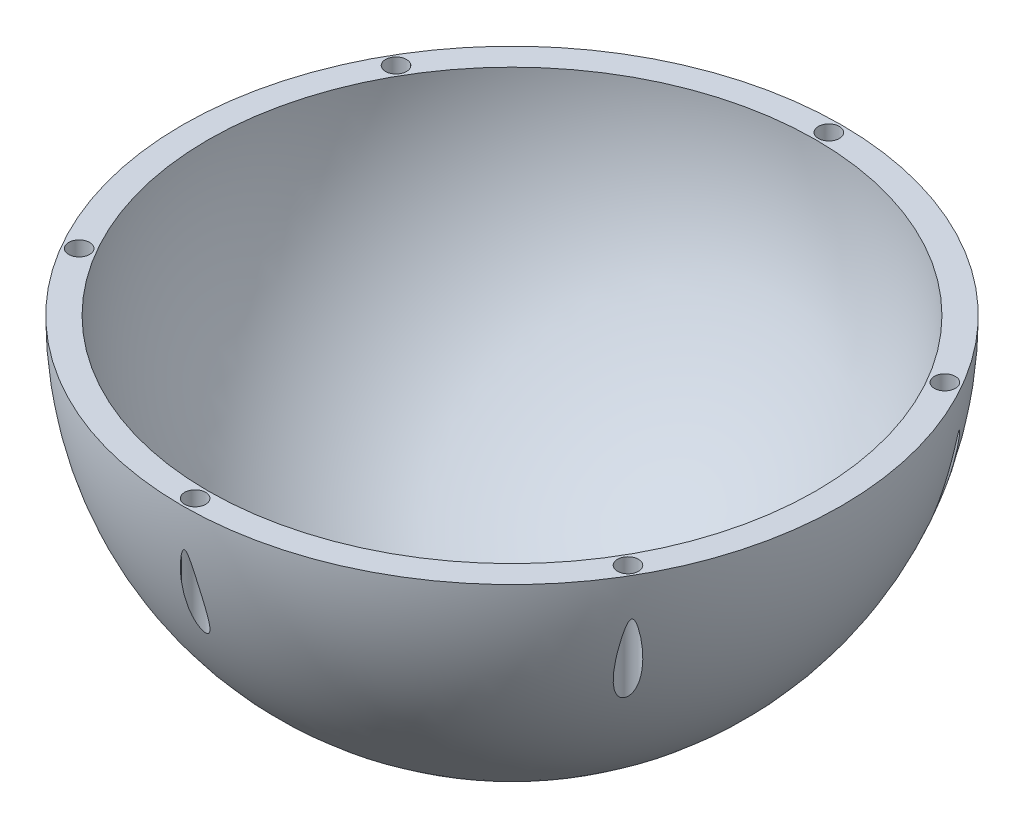
from build123d import *

# Parameters (mm, degrees)
SKETCH2_R          = 3.937
CUT_EXTRUDE1_DEPTH = 215.6911617


with BuildPart() as part:
    # Sketch1 → Revolve1 (revolve)
    with BuildSketch(Plane.XY):
        with BuildLine():
            Line((-114.3, 0), (-123.952, 0))
            ThreePointArc((-123.952, 0), (-87.647299742, -87.647299742), (0, -123.952))
            Line((0, -123.952), (0, -114.3))
            ThreePointArc((0, -114.3), (-80.82230509, -80.82230509), (-114.3, 0))
        make_face()
    revolve(axis=Axis((0, 0, 0), (0, -1, 0)))

    # Sketch2 → Cut-Extrude1 (cut, through all)
    with BuildSketch(Plane(origin=(0, 0, 0), x_dir=(1, 0, 0), z_dir=(0, 1, 0))):
        with Locations((0, 119.126)):
            Circle(SKETCH2_R)
        with Locations((103.166142251, 59.563)):
            Circle(SKETCH2_R)
        with Locations((103.166142251, -59.563)):
            Circle(SKETCH2_R)
        with Locations((0, -119.126)):
            Circle(SKETCH2_R)
        with Locations((-103.166142251, -59.563)):
            Circle(SKETCH2_R)
        with Locations((-103.166142251, 59.563)):
            Circle(SKETCH2_R)
    extrude(amount=-CUT_EXTRUDE1_DEPTH, mode=Mode.SUBTRACT)


solid = part.part
